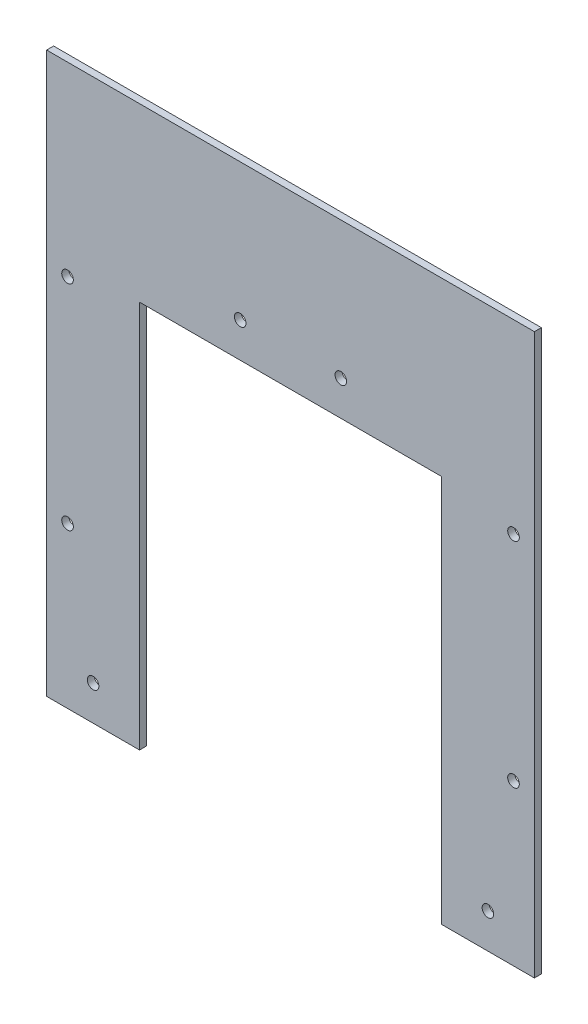
from build123d import *

# Parameters (mm, degrees)
CROQUIS1_R              = 2.5
SALIENTE_EXTRUIR1_DEPTH = 3


with BuildPart() as part:
    # Croquis1 → Saliente-Extruir1 (new body)
    with BuildSketch(Plane.XY):
        Polygon((70, 0), (70, 167), (-60, 167), (-60, 0), (-100, 0), (-100, 241), (110, 241), (110, 0), align=None)
        with Locations((-80, 15)):
            Circle(CROQUIS1_R, mode=Mode.SUBTRACT)
        with Locations((-91, 69.01)):
            Circle(CROQUIS1_R, mode=Mode.SUBTRACT)
        with Locations((-91, 161.01)):
            Circle(CROQUIS1_R, mode=Mode.SUBTRACT)
        with Locations((-16.666666667, 182)):
            Circle(CROQUIS1_R, mode=Mode.SUBTRACT)
        with Locations((26.666666667, 182)):
            Circle(CROQUIS1_R, mode=Mode.SUBTRACT)
        with Locations((101, 161.01)):
            Circle(CROQUIS1_R, mode=Mode.SUBTRACT)
        with Locations((101, 69.01)):
            Circle(CROQUIS1_R, mode=Mode.SUBTRACT)
        with Locations((90, 15)):
            Circle(CROQUIS1_R, mode=Mode.SUBTRACT)
    extrude(amount=SALIENTE_EXTRUIR1_DEPTH)


solid = part.part
